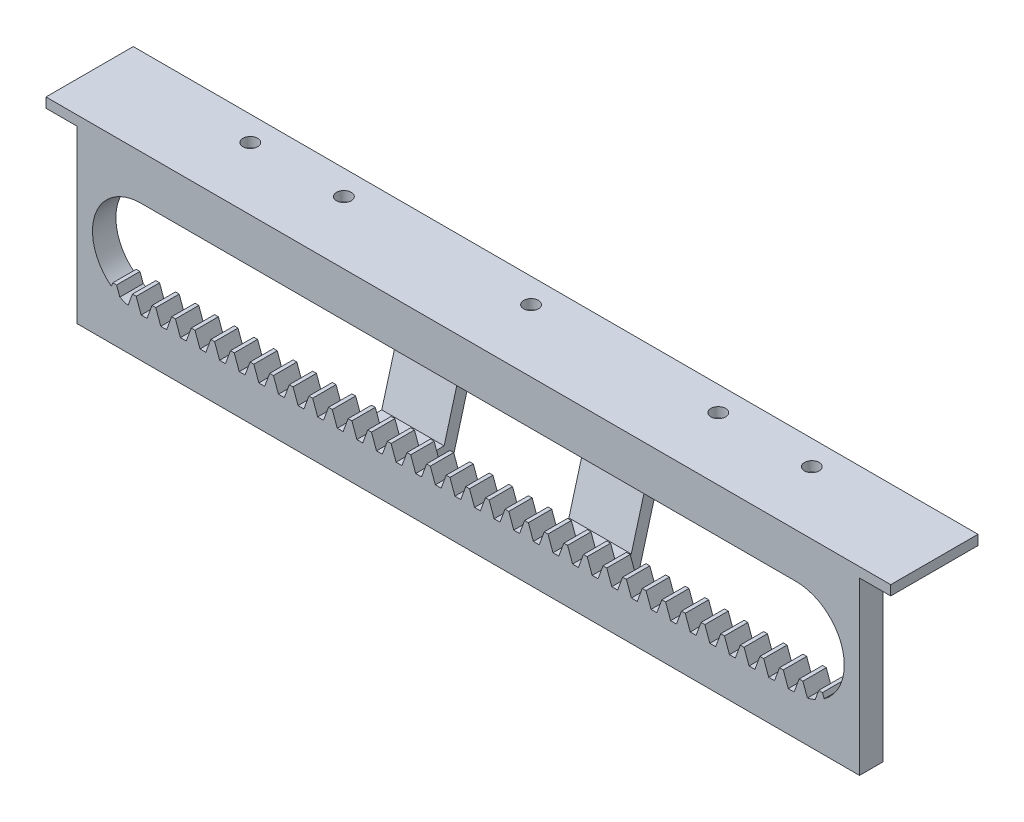
from build123d import *

# Parameters (mm, degrees)
SKETCH1_W            = 152.4
SKETCH1_H            = 4.7625
BOSS_EXTRUDE1_DEPTH  = 4.5
CUT_EXTRUDE1_DEPTH   = 153.540786042
FILLET1_START        = 21.38846
FILLET1_OUTLINE_W    = 159.258
FILLET1_OUTLINE_H    = 4.7625
FILLET1_DEPTH        = 9.0715
FILLET1_START_2      = -6.35
FILLET1_2_OUTLINE_W  = 159.258
FILLET1_2_OUTLINE_H  = 4.7625
FILLET1_2_DEPTH      = 8.05346
FILLET1_START_3      = 28.45996
FILLET1_3_OUTLINE_R  = 1.5
FILLET1_3_DEPTH      = 2
FILLET1_START_4      = 1.70346
FILLET1_4_OUTLINE_W  = 3.429
FILLET1_4_OUTLINE_H  = 4.7625
FILLET1_4_DEPTH      = 2.79654
FILLET1_START_5      = 50.8
FILLET1_5_DEPTH      = 12.7
FILLET1_START_6      = 88.9
FILLET1_6_DEPTH      = 12.7
FILLET1_START_7      = -3.429
FILLET1_7_OUTLINE_W  = 16.88846
FILLET1_7_OUTLINE_H  = 4.7625
FILLET1_7_DEPTH      = 3.1115
FILLET1_START_8      = 152.7175
FILLET1_8_OUTLINE_W  = 16.88846
FILLET1_8_OUTLINE_H  = 4.7625
FILLET1_8_DEPTH      = 3.1115
FILLET1_START_9      = 149.871525738
FILLET1_9_OUTLINE_W  = 2.79654
FILLET1_9_OUTLINE_H  = 4.7625
FILLET1_9_DEPTH      = 2.528474262
FILLET1_START_10     = -0.3175
FILLET1_10_OUTLINE_W = 2.79654
FILLET1_10_OUTLINE_H = 4.7625
FILLET1_10_DEPTH     = 1.930524682
FILLET1_START_11     = -4.7625
FILLET1_11_DEPTH     = 4.7625


with BuildPart() as part:
    # Sketch1 → Boss-Extrude1 (new body)
    with BuildSketch(Plane(origin=(0, 0, 0), x_dir=(1, 0, 0), z_dir=(0, 1, 0))):
        with Locations((76.2, 2.38125)):
            Rectangle(SKETCH1_W, SKETCH1_H)
    extrude(amount=BOSS_EXTRUDE1_DEPTH)

    # Sketch2 → Cut-Extrude1 (cut, through all)
    with BuildSketch(Plane.XY):
        Polygon((0.595167363, 4.5), (1.613024682, 1.70346), (2.208192045, 1.70346), (2.803359408, 1.70346), (3.821216727, 4.5), align=None)
        Polygon((4.586843593, 4.5), (5.604700912, 1.70346), (6.199868275, 1.70346), (6.795035638, 1.70346), (7.812892957, 4.5), align=None)
        Polygon((8.578519823, 4.5), (9.596377142, 1.70346), (10.191544505, 1.70346), (10.786711868, 1.70346), (11.804569186, 4.5), align=None)
        Polygon((12.570196052, 4.5), (13.588053371, 1.70346), (14.183220734, 1.70346), (14.778388097, 1.70346), (15.796245416, 4.5), align=None)
        Polygon((16.561872282, 4.5), (17.579729601, 1.70346), (18.174896964, 1.70346), (18.770064327, 1.70346), (19.787921646, 4.5), align=None)
        Polygon((20.553548512, 4.5), (21.571405831, 1.70346), (22.166573194, 1.70346), (22.761740557, 1.70346), (23.779597876, 4.5), align=None)
        Polygon((24.545224742, 4.5), (25.563082061, 1.70346), (26.158249424, 1.70346), (26.753416787, 1.70346), (27.771274106, 4.5), align=None)
        Polygon((28.536900972, 4.5), (29.554758291, 1.70346), (30.149925654, 1.70346), (30.745093017, 1.70346), (31.762950336, 4.5), align=None)
        Polygon((32.528577202, 4.5), (33.546434521, 1.70346), (34.141601884, 1.70346), (34.736769246, 1.70346), (35.754626565, 4.5), align=None)
        Polygon((36.520253431, 4.5), (37.53811075, 1.70346), (38.133278113, 1.70346), (38.728445476, 1.70346), (39.746302795, 4.5), align=None)
        Polygon((40.511929661, 4.5), (41.52978698, 1.70346), (42.124954343, 1.70346), (42.720121706, 1.70346), (43.737979025, 4.5), align=None)
        Polygon((44.503605891, 4.5), (45.52146321, 1.70346), (46.116630573, 1.70346), (46.711797936, 1.70346), (47.729655255, 4.5), align=None)
        Polygon((48.495282121, 4.5), (49.51313944, 1.70346), (50.108306803, 1.70346), (50.703474166, 1.70346), (51.721331485, 4.5), align=None)
        Polygon((52.486958351, 4.5), (53.50481567, 1.70346), (54.099983033, 1.70346), (54.695150396, 1.70346), (55.713007715, 4.5), align=None)
        Polygon((56.478634581, 4.5), (57.496491899, 1.70346), (58.091659262, 1.70346), (58.686826625, 1.70346), (59.704683944, 4.5), align=None)
        Polygon((60.47031081, 4.5), (61.488168129, 1.70346), (62.083335492, 1.70346), (62.678502855, 1.70346), (63.696360174, 4.5), align=None)
        Polygon((64.46198704, 4.5), (65.479844359, 1.70346), (66.075011722, 1.70346), (66.670179085, 1.70346), (67.688036404, 4.5), align=None)
        Polygon((68.45366327, 4.5), (69.471520589, 1.70346), (70.066687952, 1.70346), (70.661855315, 1.70346), (71.679712634, 4.5), align=None)
        Polygon((72.4453395, 4.5), (73.463196819, 1.70346), (74.058364182, 1.70346), (74.653531545, 1.70346), (75.671388864, 4.5), align=None)
        Polygon((76.43701573, 4.5), (77.454873049, 1.70346), (78.050040412, 1.70346), (78.645207775, 1.70346), (79.663065094, 4.5), align=None)
        Polygon((80.42869196, 4.5), (81.446549278, 1.70346), (82.041716641, 1.70346), (82.636884004, 1.70346), (83.654741323, 4.5), align=None)
        Polygon((84.420368189, 4.5), (85.438225508, 1.70346), (86.033392871, 1.70346), (86.628560234, 1.70346), (87.646417553, 4.5), align=None)
        Polygon((88.412044419, 4.5), (89.429901738, 1.70346), (90.025069101, 1.70346), (90.620236464, 1.70346), (91.638093783, 4.5), align=None)
        Polygon((92.403720649, 4.5), (93.421577968, 1.70346), (94.016745331, 1.70346), (94.611912694, 1.70346), (95.629770013, 4.5), align=None)
        Polygon((96.395396879, 4.5), (97.413254198, 1.70346), (98.008421561, 1.70346), (98.603588924, 1.70346), (99.621446243, 4.5), align=None)
        Polygon((100.387073109, 4.5), (101.404930428, 1.70346), (102.000097791, 1.70346), (102.595265154, 1.70346), (103.613122472, 4.5), align=None)
        Polygon((104.378749338, 4.5), (105.396606657, 1.70346), (105.99177402, 1.70346), (106.586941383, 1.70346), (107.604798702, 4.5), align=None)
        Polygon((108.370425568, 4.5), (109.388282887, 1.70346), (109.98345025, 1.70346), (110.578617613, 1.70346), (111.596474932, 4.5), align=None)
        Polygon((112.362101798, 4.5), (113.379959117, 1.70346), (113.97512648, 1.70346), (114.570293843, 1.70346), (115.588151162, 4.5), align=None)
        Polygon((116.353778028, 4.5), (117.371635347, 1.70346), (117.96680271, 1.70346), (118.561970073, 1.70346), (119.579827392, 4.5), align=None)
        Polygon((120.345454258, 4.5), (121.363311577, 1.70346), (121.95847894, 1.70346), (122.553646303, 1.70346), (123.571503622, 4.5), align=None)
        Polygon((124.337130488, 4.5), (125.354987807, 1.70346), (125.95015517, 1.70346), (126.545322532, 1.70346), (127.563179851, 4.5), align=None)
        Polygon((128.328806717, 4.5), (129.346664036, 1.70346), (129.941831399, 1.70346), (130.536998762, 1.70346), (131.554856081, 4.5), align=None)
        Polygon((132.320482947, 4.5), (133.338340266, 1.70346), (133.933507629, 1.70346), (134.528674992, 1.70346), (135.546532311, 4.5), align=None)
        Polygon((136.312159177, 4.5), (137.330016496, 1.70346), (137.925183859, 1.70346), (138.520351222, 1.70346), (139.538208541, 4.5), align=None)
        Polygon((140.303835407, 4.5), (141.321692726, 1.70346), (141.916860089, 1.70346), (142.512027452, 1.70346), (143.529884771, 4.5), align=None)
        Polygon((144.295511637, 4.5), (145.313368956, 1.70346), (145.908536319, 1.70346), (146.503703682, 1.70346), (147.521561001, 4.5), align=None)
        Polygon((148.287187867, 4.5), (149.305045185, 1.70346), (149.900212548, 1.70346), (150.495379911, 1.70346), (151.51323723, 4.5), align=None)
        Polygon((152.278864096, 4.5), (153.296721415, 1.70346), (153.891888778, 1.70346), (154.487056141, 1.70346), (155.50491346, 4.5), align=None)
        Polygon((156.270540326, 4.5), (157.288397645, 1.70346), (157.883565008, 1.70346), (158.478732371, 1.70346), (159.49658969, 4.5), align=None)
        Polygon((160.262216556, 4.5), (161.280073875, 1.70346), (161.875241238, 1.70346), (162.470408601, 1.70346), (163.48826592, 4.5), align=None)
        Polygon((164.253892786, 4.5), (165.271750105, 1.70346), (165.866917468, 1.70346), (166.462084831, 1.70346), (167.47994215, 4.5), align=None)
        Polygon((168.245569016, 4.5), (169.263426335, 1.70346), (169.858593698, 1.70346), (170.453761061, 1.70346), (171.47161838, 4.5), align=None)
        Polygon((172.237245246, 4.5), (173.255102564, 1.70346), (173.850269927, 1.70346), (174.44543729, 1.70346), (175.463294609, 4.5), align=None)
        Polygon((176.228921475, 4.5), (177.246778794, 1.70346), (177.841946157, 1.70346), (178.43711352, 1.70346), (179.454970839, 4.5), align=None)
        Polygon((180.220597705, 4.5), (181.238455024, 1.70346), (181.833622387, 1.70346), (182.42878975, 1.70346), (183.446647069, 4.5), align=None)
        Polygon((184.212273935, 4.5), (185.230131254, 1.70346), (185.825298617, 1.70346), (186.42046598, 1.70346), (187.438323299, 4.5), align=None)
        Polygon((188.203950165, 4.5), (189.221807484, 1.70346), (189.816974847, 1.70346), (190.41214221, 1.70346), (191.429999529, 4.5), align=None)
        Polygon((192.195626395, 4.5), (193.213483714, 1.70346), (193.808651077, 1.70346), (194.40381844, 1.70346), (195.421675758, 4.5), align=None)
        Polygon((196.187302624, 4.5), (197.205159943, 1.70346), (197.800327306, 1.70346), (198.395494669, 1.70346), (199.413351988, 4.5), align=None)
        Polygon((200.178978854, 4.5), (201.196836173, 1.70346), (201.792003536, 1.70346), (202.387170899, 1.70346), (203.405028218, 4.5), align=None)
        Polygon((204.170655084, 4.5), (205.188512403, 1.70346), (205.783679766, 1.70346), (206.378847129, 1.70346), (207.396704448, 4.5), align=None)
        Polygon((208.162331314, 4.5), (209.180188633, 1.70346), (209.775355996, 1.70346), (210.370523359, 1.70346), (211.388380678, 4.5), align=None)
        Polygon((212.154007544, 4.5), (213.171864863, 1.70346), (213.767032226, 1.70346), (214.362199589, 1.70346), (215.380056908, 4.5), align=None)
        Polygon((216.145683774, 4.5), (217.163541093, 1.70346), (217.758708456, 1.70346), (218.353875818, 1.70346), (219.371733137, 4.5), align=None)
        Polygon((220.137360003, 4.5), (221.155217322, 1.70346), (221.750384685, 1.70346), (222.345552048, 1.70346), (223.363409367, 4.5), align=None)
        Polygon((224.129036233, 4.5), (225.146893552, 1.70346), (225.742060915, 1.70346), (226.337228278, 1.70346), (227.355085597, 4.5), align=None)
        Polygon((228.120712463, 4.5), (229.138569782, 1.70346), (229.733737145, 1.70346), (230.328904508, 1.70346), (231.346761827, 4.5), align=None)
        Polygon((232.112388693, 4.5), (233.130246012, 1.70346), (233.725413375, 1.70346), (234.320580738, 1.70346), (235.338438057, 4.5), align=None)
        Polygon((236.104064923, 4.5), (237.121922242, 1.70346), (237.717089605, 1.70346), (238.312256968, 1.70346), (239.330114287, 4.5), align=None)
        Polygon((240.095741153, 4.5), (241.113598471, 1.70346), (241.708765834, 1.70346), (242.303933197, 1.70346), (243.321790516, 4.5), align=None)
        Polygon((244.087417382, 4.5), (245.105274701, 1.70346), (245.700442064, 1.70346), (246.295609427, 1.70346), (247.313466746, 4.5), align=None)
        Polygon((248.079093612, 4.5), (249.096950931, 1.70346), (249.692118294, 1.70346), (250.287285657, 1.70346), (251.305142976, 4.5), align=None)
        Polygon((252.070769842, 4.5), (253.088627161, 1.70346), (253.683794524, 1.70346), (254.278961887, 1.70346), (255.296819206, 4.5), align=None)
        Polygon((256.062446072, 4.5), (257.080303391, 1.70346), (257.675470754, 1.70346), (258.270638117, 1.70346), (259.288495436, 4.5), align=None)
        Polygon((260.054122302, 4.5), (261.071979621, 1.70346), (261.667146984, 1.70346), (262.262314347, 1.70346), (263.280171666, 4.5), align=None)
        Polygon((264.045798532, 4.5), (265.06365585, 1.70346), (265.658823213, 1.70346), (266.253990576, 1.70346), (267.271847895, 4.5), align=None)
        Polygon((268.037474761, 4.5), (269.05533208, 1.70346), (269.650499443, 1.70346), (270.245666806, 1.70346), (271.263524125, 4.5), align=None)
        Polygon((272.029150991, 4.5), (273.04700831, 1.70346), (273.642175673, 1.70346), (274.237343036, 1.70346), (275.255200355, 4.5), align=None)
        Polygon((276.020827221, 4.5), (277.03868454, 1.70346), (277.633851903, 1.70346), (278.229019266, 1.70346), (279.246876585, 4.5), align=None)
        Polygon((280.012503451, 4.5), (281.03036077, 1.70346), (281.625528133, 1.70346), (282.220695496, 1.70346), (283.238552815, 4.5), align=None)
        Polygon((284.004179681, 4.5), (285.022037, 1.70346), (285.617204363, 1.70346), (286.212371726, 1.70346), (287.230229044, 4.5), align=None)
        Polygon((287.99585591, 4.5), (289.013713229, 1.70346), (289.608880592, 1.70346), (290.204047955, 1.70346), (291.221905274, 4.5), align=None)
        Polygon((291.98753214, 4.5), (293.005389459, 1.70346), (293.600556822, 1.70346), (294.195724185, 1.70346), (295.213581504, 4.5), align=None)
        Polygon((295.97920837, 4.5), (296.997065689, 1.70346), (297.592233052, 1.70346), (298.187400415, 1.70346), (299.205257734, 4.5), align=None)
        Polygon((299.9708846, 4.5), (300.988741919, 1.70346), (301.583909282, 1.70346), (302.179076645, 1.70346), (303.196933964, 4.5), align=None)
        Polygon((303.96256083, 4.5), (304.980418149, 1.70346), (305.575585512, 1.70346), (306.170752875, 1.70346), (307.188610194, 4.5), align=None)
        Polygon((307.95423706, 4.5), (308.972094379, 1.70346), (309.567261742, 1.70346), (310.162429104, 1.70346), (311.180286423, 4.5), align=None)
        Polygon((311.945913289, 4.5), (312.963770608, 1.70346), (313.558937971, 1.70346), (314.154105334, 1.70346), (315.171962653, 4.5), align=None)
        Polygon((315.937589519, 4.5), (316.955446838, 1.70346), (317.550614201, 1.70346), (318.145781564, 1.70346), (319.163638883, 4.5), align=None)
        Polygon((319.929265749, 4.5), (320.947123068, 1.70346), (321.542290431, 1.70346), (322.137457794, 1.70346), (323.155315113, 4.5), align=None)
        Polygon((323.920941979, 4.5), (324.938799298, 1.70346), (325.533966661, 1.70346), (326.129134024, 1.70346), (327.146991343, 4.5), align=None)
        Polygon((327.912618209, 4.5), (328.930475528, 1.70346), (329.525642891, 1.70346), (330.120810254, 1.70346), (331.138667573, 4.5), align=None)
        Polygon((331.904294439, 4.5), (332.922151757, 1.70346), (333.51731912, 1.70346), (334.112486483, 1.70346), (335.130343802, 4.5), align=None)
        Polygon((335.895970668, 4.5), (336.913827987, 1.70346), (337.50899535, 1.70346), (338.104162713, 1.70346), (339.122020032, 4.5), align=None)
        Polygon((339.887646898, 4.5), (340.905504217, 1.70346), (341.50067158, 1.70346), (342.095838943, 1.70346), (343.113696262, 4.5), align=None)
        Polygon((343.879323128, 4.5), (344.897180447, 1.70346), (345.49234781, 1.70346), (346.087515173, 1.70346), (347.105372492, 4.5), align=None)
        Polygon((347.870999358, 4.5), (348.888856677, 1.70346), (349.48402404, 1.70346), (350.079191403, 1.70346), (351.097048722, 4.5), align=None)
        Polygon((351.862675588, 4.5), (352.880532907, 1.70346), (353.47570027, 1.70346), (354.070867633, 1.70346), (355.088724952, 4.5), align=None)
        Polygon((355.854351818, 4.5), (356.872209136, 1.70346), (357.467376499, 1.70346), (358.062543862, 1.70346), (359.080401181, 4.5), align=None)
        Polygon((359.846028047, 4.5), (360.863885366, 1.70346), (361.459052729, 1.70346), (362.054220092, 1.70346), (363.072077411, 4.5), align=None)
        Polygon((363.837704277, 4.5), (364.855561596, 1.70346), (365.450728959, 1.70346), (366.045896322, 1.70346), (367.063753641, 4.5), align=None)
        Polygon((367.829380507, 4.5), (368.847237826, 1.70346), (369.442405189, 1.70346), (370.037572552, 1.70346), (371.055429871, 4.5), align=None)
        Polygon((371.821056737, 4.5), (372.838914056, 1.70346), (373.434081419, 1.70346), (374.029248782, 1.70346), (375.047106101, 4.5), align=None)
        Polygon((375.812732967, 4.5), (376.830590286, 1.70346), (377.425757649, 1.70346), (378.020925012, 1.70346), (379.03878233, 4.5), align=None)
        Polygon((379.804409196, 4.5), (380.822266515, 1.70346), (381.417433878, 1.70346), (382.012601241, 1.70346), (383.03045856, 4.5), align=None)
        Polygon((383.796085426, 4.5), (384.813942745, 1.70346), (385.409110108, 1.70346), (386.004277471, 1.70346), (387.02213479, 4.5), align=None)
        Polygon((387.787761656, 4.5), (388.805618975, 1.70346), (389.400786338, 1.70346), (389.995953701, 1.70346), (391.01381102, 4.5), align=None)
        Polygon((391.779437886, 4.5), (392.797295205, 1.70346), (393.392462568, 1.70346), (393.987629931, 1.70346), (395.00548725, 4.5), align=None)
        Polygon((395.771114116, 4.5), (396.788971435, 1.70346), (397.384138798, 1.70346), (397.979306161, 1.70346), (398.99716348, 4.5), align=None)
        Polygon((399.762790346, 4.5), (400.780647665, 1.70346), (401.375815028, 1.70346), (401.97098239, 1.70346), (402.988839709, 4.5), align=None)
        Polygon((403.754466575, 4.5), (404.772323894, 1.70346), (405.367491257, 1.70346), (405.96265862, 1.70346), (406.980515939, 4.5), align=None)
        Polygon((407.746142805, 4.5), (408.764000124, 1.70346), (409.359167487, 1.70346), (409.95433485, 1.70346), (410.972192169, 4.5), align=None)
        Polygon((411.737819035, 4.5), (412.755676354, 1.70346), (413.350843717, 1.70346), (413.94601108, 1.70346), (414.963868399, 4.5), align=None)
        Polygon((415.729495265, 4.5), (416.747352584, 1.70346), (417.342519947, 1.70346), (417.93768731, 1.70346), (418.955544629, 4.5), align=None)
        Polygon((419.721171495, 4.5), (420.739028814, 1.70346), (421.334196177, 1.70346), (421.92936354, 1.70346), (422.947220859, 4.5), align=None)
        Polygon((423.712847725, 4.5), (424.730705043, 1.70346), (425.325872406, 1.70346), (425.921039769, 1.70346), (426.938897088, 4.5), align=None)
        Polygon((427.704523954, 4.5), (428.722381273, 1.70346), (429.317548636, 1.70346), (429.912715999, 1.70346), (430.930573318, 4.5), align=None)
        Polygon((431.696200184, 4.5), (432.714057503, 1.70346), (433.309224866, 1.70346), (433.904392229, 1.70346), (434.922249548, 4.5), align=None)
        Polygon((435.687876414, 4.5), (436.705733733, 1.70346), (437.300901096, 1.70346), (437.896068459, 1.70346), (438.913925778, 4.5), align=None)
        Polygon((439.679552644, 4.5), (440.697409963, 1.70346), (441.292577326, 1.70346), (441.887744689, 1.70346), (442.905602008, 4.5), align=None)
        Polygon((443.671228874, 4.5), (444.689086193, 1.70346), (445.284253556, 1.70346), (445.879420919, 1.70346), (446.897278238, 4.5), align=None)
        Polygon((447.662905104, 4.5), (448.680762422, 1.70346), (449.275929785, 1.70346), (449.871097148, 1.70346), (450.888954467, 4.5), align=None)
        Polygon((451.654581333, 4.5), (452.672438652, 1.70346), (453.267606015, 1.70346), (453.862773378, 1.70346), (454.880630697, 4.5), align=None)
        Polygon((455.646257563, 4.5), (456.664114882, 1.70346), (457.259282245, 1.70346), (457.854449608, 1.70346), (458.872306927, 4.5), align=None)
        Polygon((459.637933793, 4.5), (460.655791112, 1.70346), (461.250958475, 1.70346), (461.846125838, 1.70346), (462.863983157, 4.5), align=None)
        Polygon((463.629610023, 4.5), (464.647467342, 1.70346), (465.242634705, 1.70346), (465.837802068, 1.70346), (466.855659387, 4.5), align=None)
        Polygon((467.621286253, 4.5), (468.639143572, 1.70346), (469.234310935, 1.70346), (469.829478298, 1.70346), (470.847335616, 4.5), align=None)
        Polygon((471.612962482, 4.5), (472.630819801, 1.70346), (473.225987164, 1.70346), (473.821154527, 1.70346), (474.839011846, 4.5), align=None)
        Polygon((475.604638712, 4.5), (476.622496031, 1.70346), (477.217663394, 1.70346), (477.812830757, 1.70346), (478.830688076, 4.5), align=None)
        Polygon((479.596314942, 4.5), (480.614172261, 1.70346), (481.209339624, 1.70346), (481.804506987, 1.70346), (482.822364306, 4.5), align=None)
        Polygon((483.587991172, 4.5), (484.605848491, 1.70346), (485.201015854, 1.70346), (485.796183217, 1.70346), (486.814040536, 4.5), align=None)
        Polygon((487.579667402, 4.5), (488.597524721, 1.70346), (489.192692084, 1.70346), (489.787859447, 1.70346), (490.805716766, 4.5), align=None)
        Polygon((491.571343632, 4.5), (492.589200951, 1.70346), (493.184368314, 1.70346), (493.779535676, 1.70346), (494.797392995, 4.5), align=None)
        Polygon((495.563019861, 4.5), (496.58087718, 1.70346), (497.176044543, 1.70346), (497.771211906, 1.70346), (498.789069225, 4.5), align=None)
    extrude(amount=-CUT_EXTRUDE1_DEPTH, mode=Mode.SUBTRACT)

    # Fillet1 2 outline → Fillet1 2 (add)
    with BuildSketch(Plane(origin=(0, 0, 0), x_dir=(1, 0, 0), z_dir=(0, 1, 0)).offset(FILLET1_START_2)):
        with Locations((76.2, 2.38125)):
            Rectangle(FILLET1_2_OUTLINE_W, FILLET1_2_OUTLINE_H)
    extrude(amount=FILLET1_2_DEPTH)

    # Fillet1 4 outline → Fillet1 4 (add)
    with BuildSketch(Plane(origin=(0, 0, 0), x_dir=(1, 0, 0), z_dir=(0, 1, 0)).offset(FILLET1_START_4)):
        with Locations((-1.7145, 2.38125)):
            Rectangle(FILLET1_4_OUTLINE_W, FILLET1_4_OUTLINE_H)
        with Locations((154.1145, 2.38125)):
            Rectangle(FILLET1_4_OUTLINE_W, FILLET1_4_OUTLINE_H)
    extrude(amount=FILLET1_4_DEPTH)



with BuildPart() as body_2:
    # Fillet1: read off the stored shape, not the designer's step
    # Fillet1 outline → Fillet1 (new body)
    with BuildSketch(Plane(origin=(0, 0, 0), x_dir=(1, 0, 0), z_dir=(0, 1, 0)).offset(FILLET1_START)):
        with Locations((76.2, 2.38125)):
            Rectangle(FILLET1_OUTLINE_W, FILLET1_OUTLINE_H)
    extrude(amount=FILLET1_DEPTH)

    # Fillet1 3 outline → Fillet1 3 (add)
    with BuildSketch(Plane(origin=(0, 0, 0), x_dir=(1, 0, 0), z_dir=(0, 1, 0)).offset(FILLET1_START_3)):
        Polygon((155.829, 4.7625), (155.829, 0), (162.179, 0), (162.179, 17.76349), (-9.779, 17.76349), (-9.779, 0), (-3.429, 0), (-3.429, 4.7625), align=None)
        with Locations((38.1, 12.7635)):
            Circle(FILLET1_3_OUTLINE_R, mode=Mode.SUBTRACT)
        with Locations((19.05, 12.7635)):
            Circle(FILLET1_3_OUTLINE_R, mode=Mode.SUBTRACT)
        with Locations((76.2, 12.7635)):
            Circle(FILLET1_3_OUTLINE_R, mode=Mode.SUBTRACT)
        with Locations((133.35, 12.7635)):
            Circle(FILLET1_3_OUTLINE_R, mode=Mode.SUBTRACT)
        with Locations((114.3, 12.7635)):
            Circle(FILLET1_3_OUTLINE_R, mode=Mode.SUBTRACT)
    extrude(amount=FILLET1_3_DEPTH)


with BuildPart() as part_1:
    add(part.part)

    add(body_2.part)  # Fillet1 5 merges body 2
    # Fillet1 5 outline → Fillet1 5 (add)
    with BuildSketch(Plane.YZ.offset(FILLET1_START_5)):
        with BuildLine():
            Line((1.70346, -7.7635), (1.70346, -4.7625))
            Line((1.70346, -4.7625), (-6.35, -4.7625))
            Line((-6.35, -4.7625), (-6.35, -8.181031482))
            Line((-6.35, -8.181031482), (28.45996, -17.76349))
            Line((28.45996, -17.76349), (28.45996, -11.795317507))
            ThreePointArc((28.45996, -11.795317507), (27.459327047, -13.81570091), (25.245826855, -14.244224304))
            Line((25.245826855, -14.244224304), (1.70346, -7.7635))
        make_face()
    extrude(amount=FILLET1_5_DEPTH)

    # Fillet1 6 outline → Fillet1 6 (add)
    with BuildSketch(Plane.YZ.offset(FILLET1_START_6)):
        with BuildLine():
            Line((1.70346, -7.7635), (1.70346, -4.7625))
            Line((1.70346, -4.7625), (-6.35, -4.7625))
            Line((-6.35, -4.7625), (-6.35, -8.181031482))
            Line((-6.35, -8.181031482), (28.45996, -17.76349))
            Line((28.45996, -17.76349), (28.45996, -11.795317507))
            ThreePointArc((28.45996, -11.795317507), (27.459327047, -13.81570091), (25.245826855, -14.244224304))
            Line((25.245826855, -14.244224304), (1.70346, -7.7635))
        make_face()
    extrude(amount=FILLET1_6_DEPTH)

    # Fillet1 7 outline → Fillet1 7 (add)
    with BuildSketch(Plane.YZ.offset(FILLET1_START_7)):
        with Locations((12.94423, -2.38125)):
            Rectangle(FILLET1_7_OUTLINE_W, FILLET1_7_OUTLINE_H)
    extrude(amount=FILLET1_7_DEPTH)

    # Fillet1 8 outline → Fillet1 8 (add)
    with BuildSketch(Plane.YZ.offset(FILLET1_START_8)):
        with Locations((12.94423, -2.38125)):
            Rectangle(FILLET1_8_OUTLINE_W, FILLET1_8_OUTLINE_H)
    extrude(amount=FILLET1_8_DEPTH)

    # Fillet1 9 outline → Fillet1 9 (add)
    with BuildSketch(Plane.YZ.offset(FILLET1_START_9)):
        with Locations((3.10173, -2.38125)):
            Rectangle(FILLET1_9_OUTLINE_W, FILLET1_9_OUTLINE_H)
    extrude(amount=FILLET1_9_DEPTH)

    # Fillet1 10 outline → Fillet1 10 (add)
    with BuildSketch(Plane.YZ.offset(FILLET1_START_10)):
        with Locations((3.10173, -2.38125)):
            Rectangle(FILLET1_10_OUTLINE_W, FILLET1_10_OUTLINE_H)
    extrude(amount=FILLET1_10_DEPTH)

    # Fillet1 11 outline → Fillet1 11 (add)
    with BuildSketch(Plane.XY.offset(FILLET1_START_11)):
        with BuildLine():
            ThreePointArc((6.922532349, 2.053754336), (6.071484857, 2.329233932), (5.248962864, 2.680842253))
            Line((5.248962864, 2.680842253), (5.604700912, 1.70346))
            Line((5.604700912, 1.70346), (6.795035638, 1.70346))
            Line((6.795035638, 1.70346), (6.922532349, 2.053754336))
        make_face()
        with BuildLine():
            ThreePointArc((3.541381468, 3.731158946), (0.69979259, 7.188148574), (-0.3175, 11.54596))
            Line((-0.3175, 11.54596), (-0.3175, 4.5))
            Line((-0.3175, 4.5), (1.613024682, 4.5))
            Line((1.613024682, 4.5), (1.613024682, 1.70346))
            Line((1.613024682, 1.70346), (2.803359408, 1.70346))
            Line((2.803359408, 1.70346), (3.541381468, 3.731158946))
        make_face()
        with BuildLine():
            Line((146.503703682, 1.70346), (146.801039788, 2.520384238))
            ThreePointArc((146.801039788, 2.520384238), (146.017460258, 2.21859436), (145.211009281, 1.984690895))
            Line((145.211009281, 1.984690895), (145.313368956, 1.70346))
            Line((145.313368956, 1.70346), (146.503703682, 1.70346))
        make_face()
        with BuildLine():
            Line((152.7175, 4.5), (152.7175, 11.54596))
            ThreePointArc((152.7175, 11.54596), (151.63597594, 7.060415795), (148.629086118, 3.560642274))
            Line((148.629086118, 3.560642274), (149.305045185, 1.70346))
            Line((149.305045185, 1.70346), (149.871525738, 1.70346))
            Line((149.871525738, 1.70346), (149.871525738, 4.5))
            Line((149.871525738, 4.5), (152.7175, 4.5))
        make_face()
        with BuildLine():
            Line((152.7175, 21.38846), (142.875, 21.38846))
            ThreePointArc((142.875, 21.38846), (149.834698494, 18.505658494), (152.7175, 11.54596))
            Line((152.7175, 11.54596), (152.7175, 21.38846))
        make_face()
        with BuildLine():
            ThreePointArc((-0.3175, 11.54596), (2.565301506, 18.505658494), (9.525, 21.38846))
            Line((9.525, 21.38846), (-0.3175, 21.38846))
            Line((-0.3175, 21.38846), (-0.3175, 11.54596))
        make_face()
    extrude(amount=FILLET1_11_DEPTH)


solid = part_1.part
